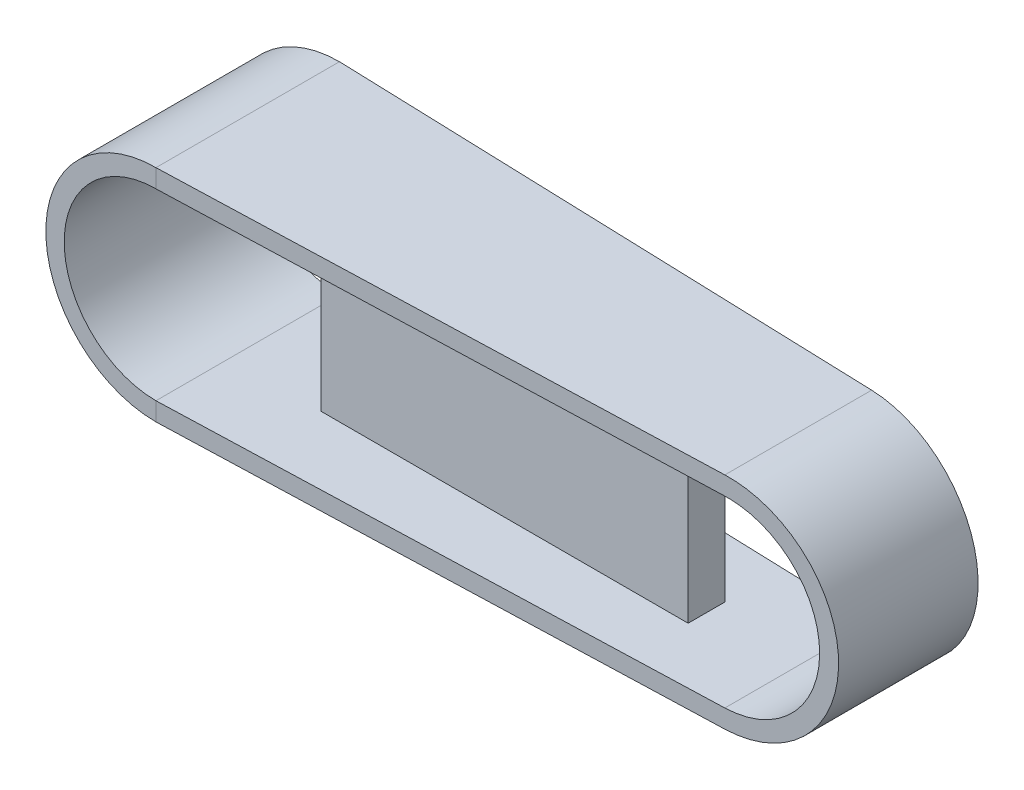
from build123d import *

# Parameters (mm, degrees)
BOSS_EXTRUDE1_DEPTH = 10
SKETCH2_W           = 20
SKETCH2_H           = 2
BOSS_EXTRUDE2_DEPTH = 10
CUT_EXTRUDE1_START  = -12
CUT_EXTRUDE1_DEPTH  = 12


# Read off the part's stored shape, not the designer's step: Cut-Extrude1
with BuildPart() as part:
    # Sketch1 → Boss-Extrude1 (new body)
    with BuildSketch(Plane.XY):
        with BuildLine():
            Line((0, -6), (-30, -6))
            ThreePointArc((-30, -6), (-36, 0), (-30, 6))
            Line((-30, 6), (0, 6))
            ThreePointArc((0, 6), (6, 0), (0, -6))
        make_face()
        with BuildLine():
            Line((-30, 5), (0, 5))
            ThreePointArc((0, 5), (5, 0), (0, -5))
            Line((0, -5), (-30, -5))
            ThreePointArc((-30, -5), (-35, 0), (-30, 5))
        make_face(mode=Mode.SUBTRACT)
    extrude(amount=BOSS_EXTRUDE1_DEPTH)

    # Sketch2 → Boss-Extrude2 (add)
    with BuildSketch(Plane(origin=(0, -5, 0), x_dir=(1, 0, 0), z_dir=(0, 1, 0))):
        with Locations((-15, -5)):
            Rectangle(SKETCH2_W, SKETCH2_H)
    extrude(amount=BOSS_EXTRUDE2_DEPTH)

    # Cut-Extrude1 outline → Cut-Extrude1 (cut)
    with BuildSketch(Plane(origin=(0, 6, 0), x_dir=(1, 0, 0), z_dir=(0, 1, 0)).offset(CUT_EXTRUDE1_START)):
        Polygon((6, -8.8), (-30, -10), (7, -10), (7, -8.766666667), align=None)
        Polygon((6, -1.2), (7, -1.233333333), (7, 0), (-30, 0), align=None)
    extrude(amount=CUT_EXTRUDE1_DEPTH, mode=Mode.SUBTRACT)


solid = part.part
